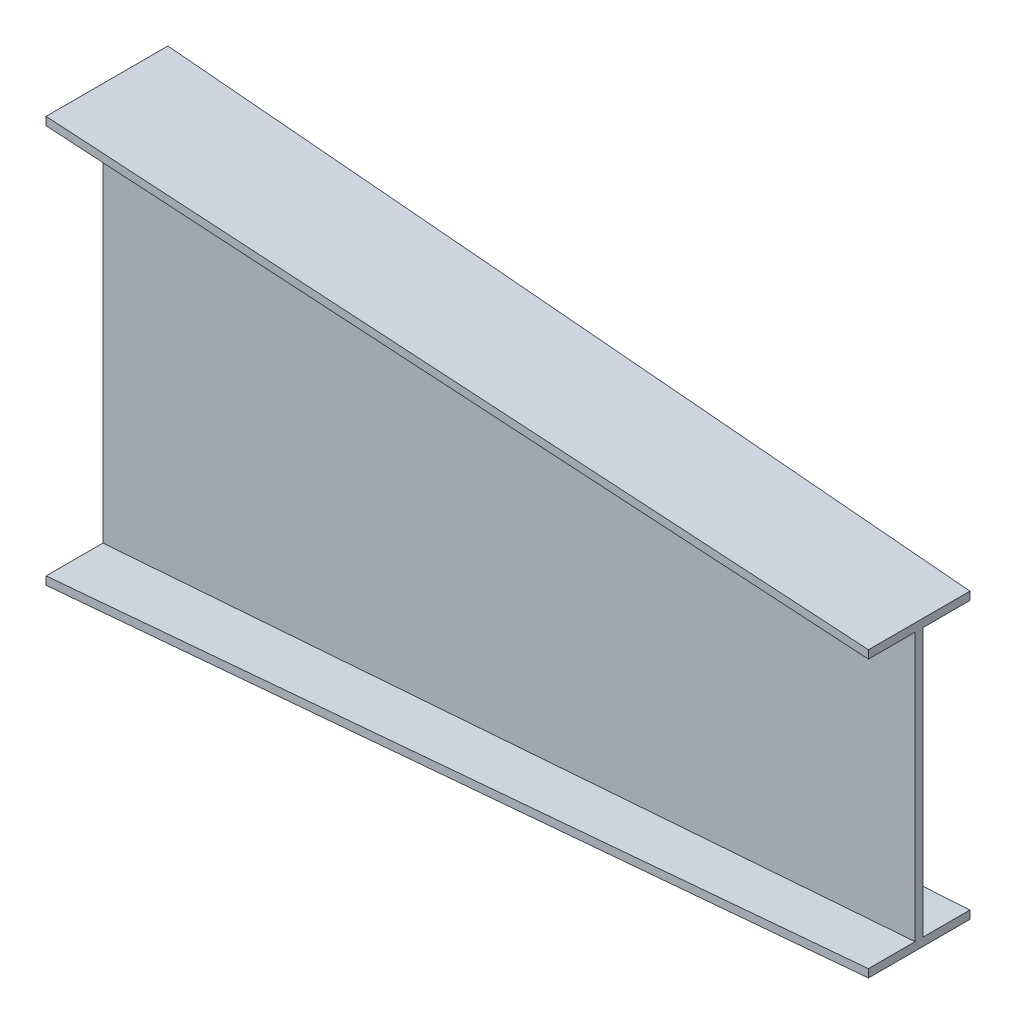
from build123d import *


with BuildPart() as part:
    # Sketch1 → Loft l3 section 0
    with BuildSketch(Plane(origin=(0, 0, 0), x_dir=(0, 0, -1), z_dir=(1, 0, 0))):
        with BuildLine():
            Line((-80, 250), (70, 250))
            Line((70, 250), (70, 240))
            Line((70, 240), (0, 240))
            Line((0, 240), (0, -240))
            Line((0, -240), (70, -240))
            Line((70, -240), (70, -250))
            Line((70, -250), (-80, -250))
            Line((-80, -250), (-80, -240))
            Line((-80, -240), (-10, -240))
            Line((-10, -240), (-10, 240))
            Line((-10, 240), (-80, 240))
            Line((-80, 240), (-80, 250))
        make_face()
    # Sketch4 → Loft l3 section 1
    with BuildSketch(Plane(origin=(1000, 0, -1000), x_dir=(0, 0, 1), z_dir=(-1, 0, 0))):
        with BuildLine():
            Line((942.5, 175), (1067.5, 175))
            Line((1067.5, 175), (1067.5, 165))
            Line((1067.5, 165), (1010, 165))
            Line((1010, 165), (1010, -165))
            Line((1010, -165), (1067.5, -165))
            Line((1067.5, -165), (1067.5, -175))
            Line((1067.5, -175), (942.5, -175))
            Line((942.5, -175), (942.5, -165))
            Line((942.5, -165), (1000, -165))
            Line((1000, -165), (1000, 165))
            Line((1000, 165), (942.5, 165))
            Line((942.5, 165), (942.5, 175))
        make_face()
    loft()


solid = part.part
